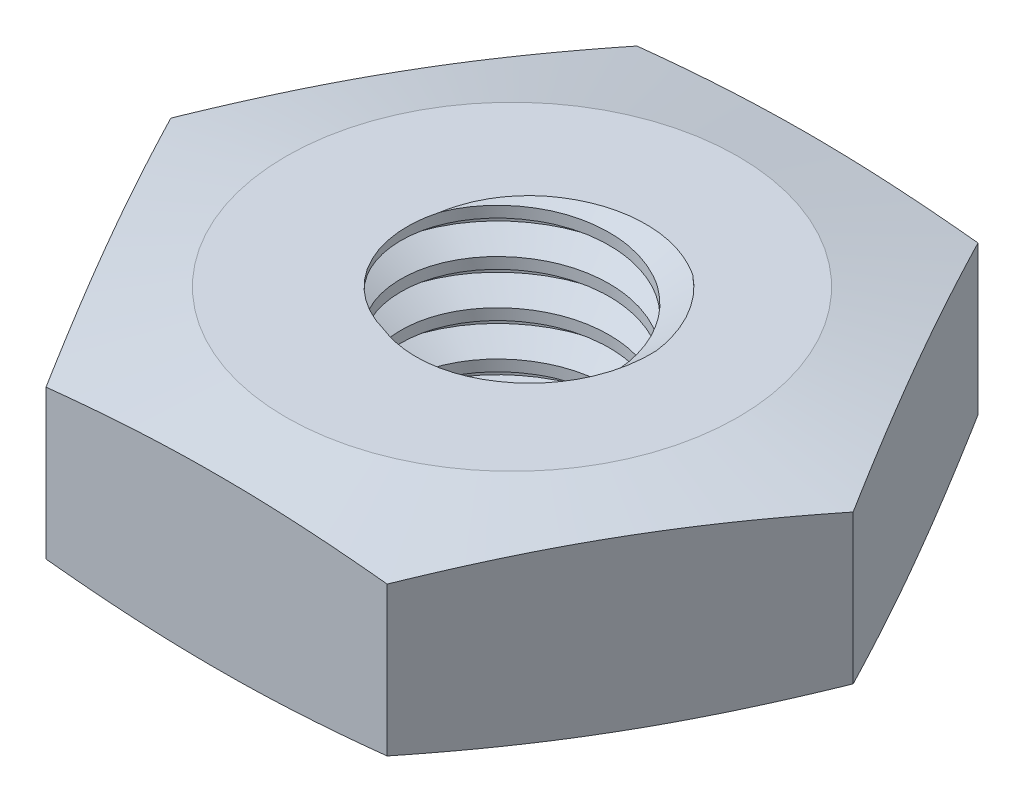
from build123d import *

# Parameters (mm, degrees)
BOSS_EXTRUDE1_DEPTH       = 1.56
M4X0_7_TAPPED_HOLE1_D     = 3.3
M4X0_7_TAPPED_HOLE1_DEPTH = 7.6
M4X0_7_TAPPED_HOLE1_TIP   = 0.991420021
THREAD1_PITCH             = 0.7


with BuildPart() as part:
    # Sketch1 → Boss-Extrude1 (new, symmetric)
    with BuildSketch(Plane(origin=(0, 0, 0), x_dir=(1, 0, 0), z_dir=(0, 1, 0))):
        Polygon((-2.690452254, -4.66), (2.690452254, -4.66), (5.380904509, 0), (2.690452254, 4.66), (-2.690452254, 4.66), (-5.380904509, 0), align=None)
    extrude(amount=BOSS_EXTRUDE1_DEPTH, both=True)

    # M4x0.7 Tapped Hole1
    with Locations(Plane(origin=(0, -1.56, 0), x_dir=(-1, 0, 0), z_dir=(0, -1, 0))):
        with Locations((0, 0)):
            Hole(M4X0_7_TAPPED_HOLE1_D / 2, depth=M4X0_7_TAPPED_HOLE1_DEPTH)
            with Locations((0, 0, -(M4X0_7_TAPPED_HOLE1_DEPTH + M4X0_7_TAPPED_HOLE1_TIP / 2))):  # 118° drill point
                Cone(0, M4X0_7_TAPPED_HOLE1_D / 2, M4X0_7_TAPPED_HOLE1_TIP, mode=Mode.SUBTRACT)

    # Thread1: the profile of Thread Profile1 profile screwed along a right-hand helix of 14.285714 turns, 6 arcs to a turn; built about Z, then put on its axis
    thread1_z = Axis((0, 0, 0), (0, 0, 1))
    thread1_corners = [(1.6497, 0, -0.000173205), (2.028886112, 0, 0.218749999), (2.028886112, 0, 0.306249999), (1.6497, 0, 0.525173203)]
    with BuildLine(mode=Mode.PRIVATE) as thread1_profile:
        Line(thread1_corners[0], thread1_corners[1])
        Line(thread1_corners[1], thread1_corners[2])
        Line(thread1_corners[2], thread1_corners[3])
        Line(thread1_corners[3], thread1_corners[0])
    thread1_cap = Face(thread1_profile.wire())
    thread1_turn_angles = [0, 30, 60, 90, 120, 150, 180, 210, 240, 270, 300, 330, 360]
    thread1_turn_weights = [1, 0.8660254037844387, 1, 0.8660254037844387, 1, 0.8660254037844387, 1, 0.8660254037844387, 1, 0.8660254037844387, 1, 0.8660254037844387, 1]
    thread1_turn_rails = [Edge.make_bspline([Vector(p[0], p[1], 0).rotate(thread1_z, thread1_turn_angles[k]) / thread1_turn_weights[k] + Vector(0, 0, p[2] + THREAD1_PITCH * thread1_turn_angles[k] / 360) for k in range(13)], [0, 0, 0, 1, 1, 2, 2, 3, 3, 4, 4, 5, 5, 6, 6, 6], 2, thread1_turn_weights) for p in thread1_corners]
    thread1_turn_sides = [Face.make_surface_from_curves(thread1_turn_rails[p[0]], thread1_turn_rails[p[1]]) for p in [(0, 1), (1, 2), (2, 3), (3, 0)]]
    thread1_last_angles = [5040, 5070, 5100, 5121.428571429, 5142.857142857]
    thread1_last_weights = [1, 0.8660254037844387, 1, 0.9308737486442035, 1]
    thread1_last_rails = [Edge.make_bspline([Vector(p[0], p[1], 0).rotate(thread1_z, thread1_last_angles[k]) / thread1_last_weights[k] + Vector(0, 0, p[2] + THREAD1_PITCH * thread1_last_angles[k] / 360) for k in range(5)], [0, 0, 0, 1, 1, 2, 2, 2], 2, thread1_last_weights) for p in thread1_corners]
    thread1_last_sides = [Face.make_surface_from_curves(thread1_last_rails[p[0]], thread1_last_rails[p[1]]) for p in [(0, 1), (1, 2), (2, 3), (3, 0)]]
    thread1 = Plane(origin=(0, -1.56, 0), x_dir=(1, 0, 0), z_dir=(0, 1, 0)) * Solid(Shell([*[p.moved(Location((0, 0, THREAD1_PITCH * i))) for i in range(14) for p in thread1_turn_sides], *thread1_last_sides, thread1_cap, thread1_cap.rotate(thread1_z, 5142.857142857).moved(Location((0, 0, THREAD1_PITCH * 5142.857142857 / 360)))]))
    add(thread1, mode=Mode.SUBTRACT)

    # Sketch6 → Cut-Revolve1 (revolve, cut)
    with BuildSketch(Plane.XY, mode=Mode.PRIVATE) as cut_revolve1_sk:
        Polygon((3.565070412, 1.56), (5.380904509, 1.56), (5.380904509, 1.174032548), align=None)
    cut_revolve1 = revolve(cut_revolve1_sk.sketch.rotate(Axis((0, 0, 0), (0, 1, 0)), 90), axis=Axis((0, 0, 0), (0, 1, 0)), mode=Mode.SUBTRACT)

    # Mirror1: Cut-Revolve1 across plane
    add(cut_revolve1.mirror(Plane.ZX), mode=Mode.SUBTRACT)


solid = part.part
